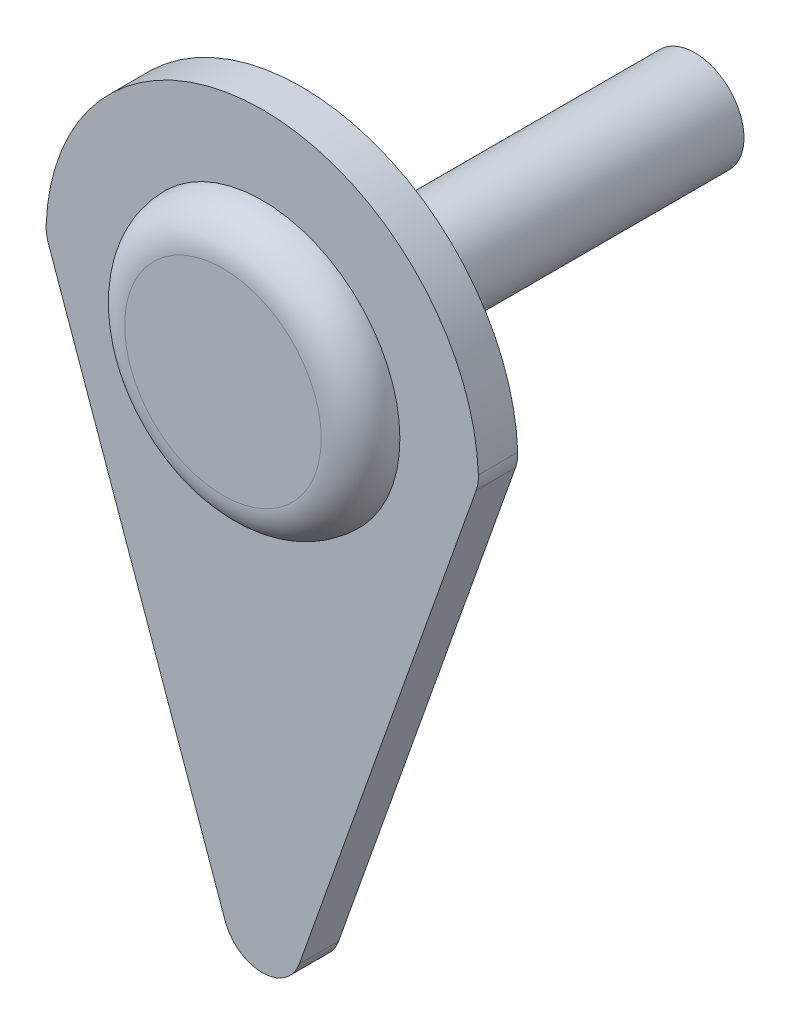
from build123d import *

# Parameters (mm, degrees)
DODANIE_WYCI_GNI_CIE1_DEPTH = 1
SZKIC2_R                    = 3.5
DODANIE_WYCI_GNI_CIE2_DEPTH = 1
SZKIC3_R                    = 1.25
DODANIE_WYCI_GNI_CIE3_DEPTH = 10
ZAOKR_GLENIE1_R             = 1


with BuildPart() as part:
    # Szkic1 → Dodanie-wyciągnięcie1 (new body)
    with BuildSketch(Plane.XY):
        with BuildLine():
            Line((0.942427745, 2.655932737), (5.439447033, 15.32935073))
            ThreePointArc((5.439447033, 15.32935073), (5.485445584, 15.51205871), (5.496356907, 15.700151814))
            ThreePointArc((5.496356907, 15.700151814), (0, 21), (-5.496356907, 15.700151814))
            ThreePointArc((-5.496356907, 15.700151814), (-5.485445584, 15.51205871), (-5.439447033, 15.32935073))
            Line((-5.439447033, 15.32935073), (-0.942427745, 2.655932737))
            ThreePointArc((-0.942427745, 2.655932737), (0, 1.990342582), (0.942427745, 2.655932737))
        make_face()
    extrude(amount=DODANIE_WYCI_GNI_CIE1_DEPTH)

    # Szkic2 → Dodanie-wyciągnięcie2 (add)
    with BuildSketch(Plane.XY.offset(1)):
        with Locations((0, 15.5)):
            Circle(SZKIC2_R)
    extrude(amount=DODANIE_WYCI_GNI_CIE2_DEPTH)

    # Szkic3 → Dodanie-wyciągnięcie3 (add)
    with BuildSketch(Plane(origin=(0, 0, 0), x_dir=(-1, 0, 0), z_dir=(0, 0, -1))):
        with Locations((0, 15.5)):
            Circle(SZKIC3_R)
    extrude(amount=DODANIE_WYCI_GNI_CIE3_DEPTH)

    # Zaokrąglenie1
    zaokr_glenie1_edges = [part.edges().sort_by_distance(p)[0] for p in [
        (-3.5, 15.5, 2),
    ]]
    fillet(zaokr_glenie1_edges, radius=ZAOKR_GLENIE1_R - 0.0001)  # a hair under: the kernel refuses the full size


solid = part.part
